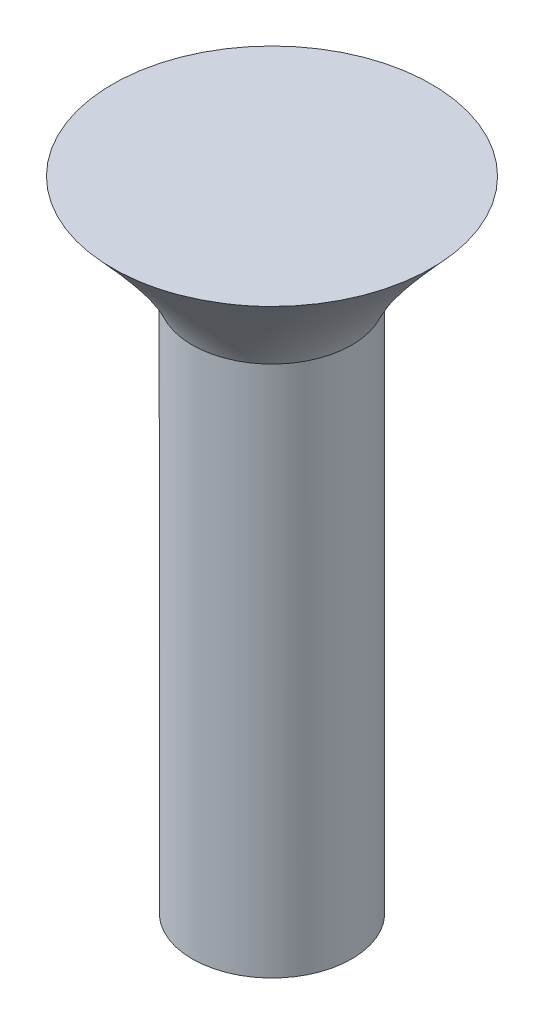
from build123d import *

# Parameters (mm, degrees)
SKETCH1_R           = 3
BOSS_EXTRUDE1_DEPTH = 20


with BuildPart() as part:
    # Sketch1 → Boss-Extrude1 (new body)
    with BuildSketch(Plane(origin=(0, 0, 0), x_dir=(1, 0, 0), z_dir=(0, 1, 0))):
        with Locations(Location((0, 0, 0), (0, 0, 270))):
            Circle(SKETCH1_R)
    extrude(amount=BOSS_EXTRUDE1_DEPTH)

    # Loft1: read off the stored shape, not the designer's step
    # Loft1: loft between two sections, ruled curve by curve
    loft1_from = [
        Edge.make_bspline([(-2.73420983, 20, -1.234543076), (-5.203295982, 20, 4.233876584), (0.265123678, 20, 6.702962736), (2.73420983, 20, 1.234543076), (5.203295982, 20, -4.233876584), (-0.265123678, 20, -6.702962736), (-2.73420983, 20, -1.234543076)], [0, 0, 0, 0, 0.5, 0.5, 0.5, 1, 1, 1, 1], 3, [1, 0.333333333, 0.333333333, 1, 0.333333333, 0.333333333, 1]),
    ]
    loft1_to = [
        Edge.make_bspline([(-2.703769597, 24.000000128, -5.356270154), (-13.416309906, 24.000000128, 0.051269039), (-8.008770712, 24.000000128, 10.763809348), (2.703769597, 24.000000128, 5.356270154), (13.416309906, 24.000000128, -0.051269039), (8.008770712, 24.000000128, -10.763809348), (-2.703769597, 24.000000128, -5.356270154)], [0, 0, 0, 0, 0.5, 0.5, 0.5, 1, 1, 1, 1], 3, [1, 0.333333333, 0.333333333, 1, 0.333333333, 0.333333333, 1]),
    ]
    loft1 = Solid(Shell([*[Face.make_surface_from_curves(loft1_from[k], loft1_to[k]) for k in range(1)], Face(Wire(loft1_from)), Face(Wire(loft1_to))]))
    add(loft1)


solid = part.part
